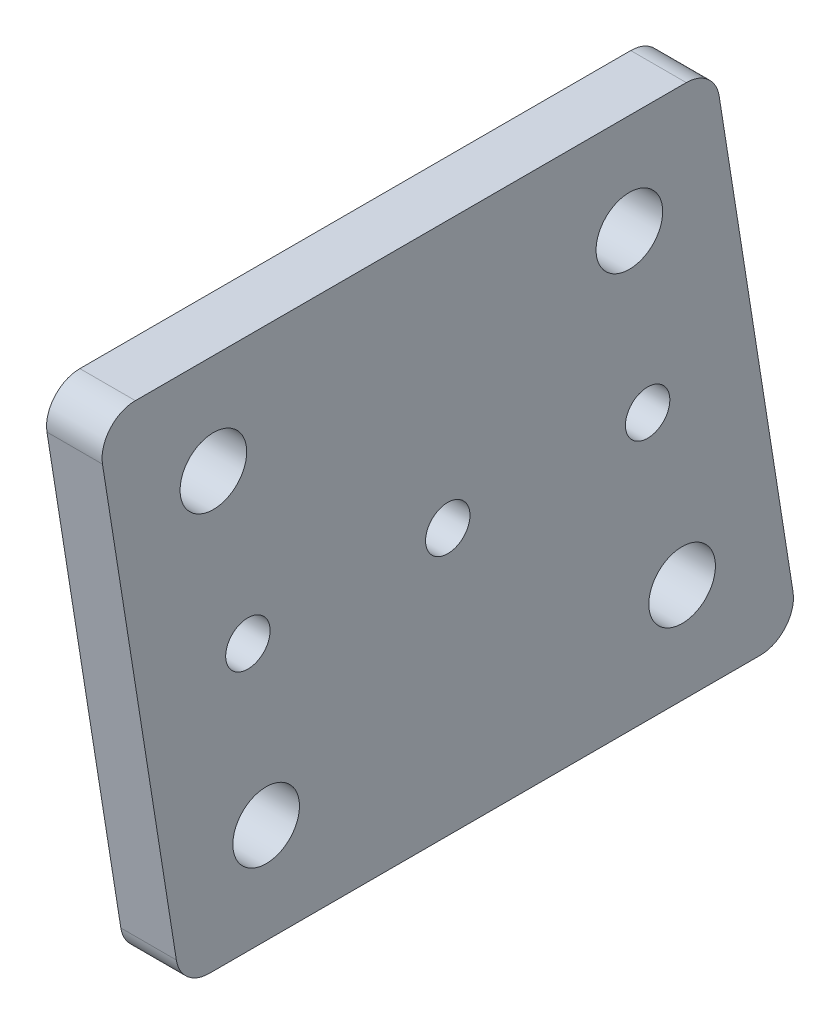
from build123d import *

# Parameters (mm, degrees)
SKETCH1_R           = 3
SKETCH1_R_2         = 2
BOSS_EXTRUDE1_DEPTH = 5
FILLET1_R           = 3


with BuildPart() as part:
    # Sketch1 → Boss-Extrude1 (new body)
    with BuildSketch(Plane(origin=(0, 0, 0), x_dir=(0, 0, -1), z_dir=(1, 0, 0))):
        Polygon((-7.686726169, -9), (47.998855749, -9), (40.396402614, 39), (-15.289179305, 39), align=None)
        Circle(SKETCH1_R, mode=Mode.SUBTRACT)
        with Locations((37.461209654, 0)):
            Circle(SKETCH1_R, mode=Mode.SUBTRACT)
        with Locations((-4.75153321, 30)):
            Circle(SKETCH1_R, mode=Mode.SUBTRACT)
        with Locations((32.709676444, 30)):
            Circle(SKETCH1_R, mode=Mode.SUBTRACT)
        with Locations((16.354838222, 15)):
            Circle(SKETCH1_R_2, mode=Mode.SUBTRACT)
        with Locations((-1.645161778, 15)):
            Circle(SKETCH1_R_2, mode=Mode.SUBTRACT)
        with Locations((34.354838222, 15)):
            Circle(SKETCH1_R_2, mode=Mode.SUBTRACT)
    extrude(amount=BOSS_EXTRUDE1_DEPTH)

    # Fillet1
    fillet1_edges = [part.edges().sort_by_distance(p)[0] for p in [
        (2.5, 39, -40.396402614),
        (2.5, -9, -47.998855749),
        (2.5, -9, 7.686726169),
        (2.5, 39, 15.289179305),
    ]]
    fillet(fillet1_edges, radius=FILLET1_R)


solid = part.part
